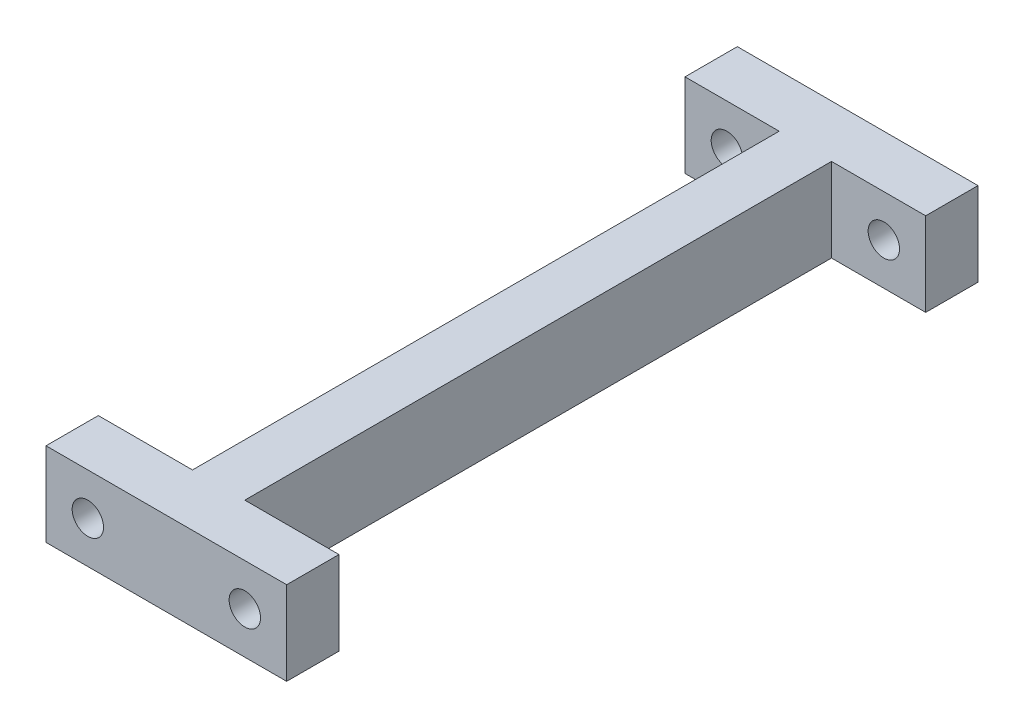
from build123d import *

# Parameters (mm, degrees)
SKETCH1_W           = 23
SKETCH1_H           = 8
SKETCH1_R           = 1.5
BOSS_EXTRUDE1_DEPTH = 5
SKETCH2_W           = 5
SKETCH2_H           = 8
BOSS_EXTRUDE2_DEPTH = 61.0706
BOSS_EXTRUDE3_START = -5
SKETCH4_W           = 23
SKETCH4_H           = 8
SKETCH4_R           = 1.5
BOSS_EXTRUDE3_DEPTH = 5


with BuildPart() as part:
    # Sketch1 → Boss-Extrude1 (new body)
    with BuildSketch(Plane.XY):
        with Locations((11.5, 4)):
            Rectangle(SKETCH1_W, SKETCH1_H)
        with Locations((4, 4)):
            Circle(SKETCH1_R, mode=Mode.SUBTRACT)
        with Locations((19, 4)):
            Circle(SKETCH1_R, mode=Mode.SUBTRACT)
    extrude(amount=BOSS_EXTRUDE1_DEPTH)

    # Sketch2 → Boss-Extrude2 (add)
    with BuildSketch(Plane.XY.offset(5)):
        with Locations((11.5, 4)):
            Rectangle(SKETCH2_W, SKETCH2_H)
    extrude(amount=BOSS_EXTRUDE2_DEPTH)

    # Sketch4 → Boss-Extrude3 (add)
    with BuildSketch(Plane.XY.offset(66.0706).offset(BOSS_EXTRUDE3_START)):
        with Locations((11.5, 4)):
            Rectangle(SKETCH4_W, SKETCH4_H)
        with Locations((4, 4)):
            Circle(SKETCH4_R, mode=Mode.SUBTRACT)
        with Locations((19, 4)):
            Circle(SKETCH4_R, mode=Mode.SUBTRACT)
    extrude(amount=BOSS_EXTRUDE3_DEPTH)


solid = part.part
